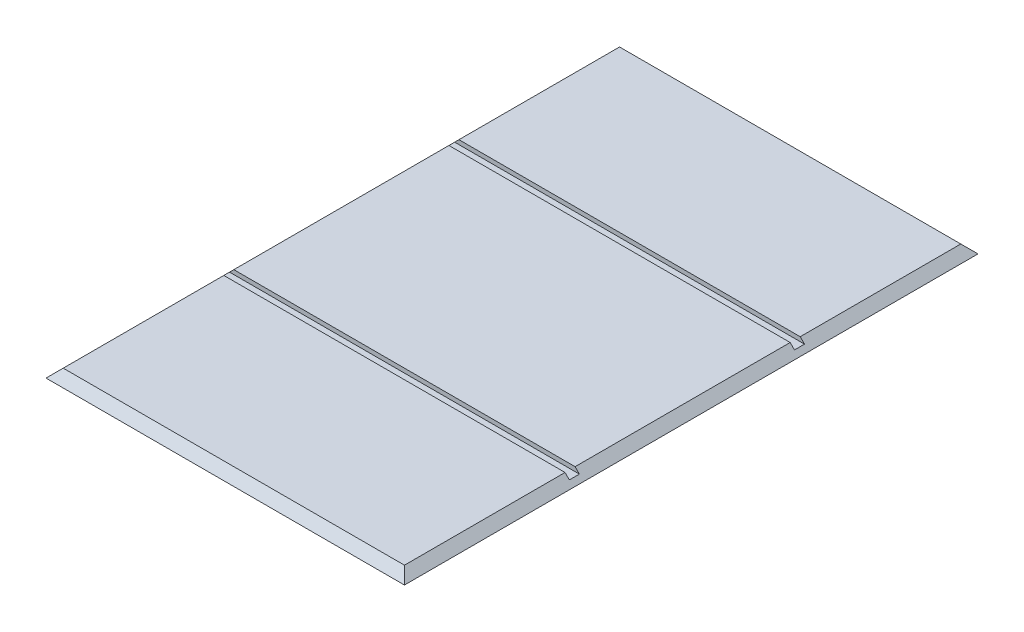
from build123d import *

# Parameters (mm, degrees)
SKETCH5_W             = 500
SKETCH5_H             = 300
BOSS_EXTRUDE1_DEPTH   = 12
SKETCH5_H_2           = 224
BOSS_EXTRUDE1_2_DEPTH = 12
BOSS_EXTRUDE1_3_DEPTH = 12
SKETCH5_3_W           = 500
SKETCH5_3_H           = 14
BOSS_EXTRUDE2_DEPTH   = 6
SKETCH5_4_W           = 500
SKETCH5_4_H           = 12
BOSS_EXTRUDE3_DEPTH   = 12
CHAMFER1_SIZE         = 12


with BuildPart() as part:
    # Sketch5 → Boss-Extrude1 (new body)
    with BuildSketch(Plane(origin=(0, 0, 0), x_dir=(1, 0, 0), z_dir=(0, 1, 0))):
        with Locations((250, 400)):
            Rectangle(SKETCH5_W, SKETCH5_H)
    extrude(amount=BOSS_EXTRUDE1_DEPTH)



with BuildPart() as body_2:
    # Sketch5 → Boss-Extrude1 2 (new body)
    with BuildSketch(Plane(origin=(0, 0, 0), x_dir=(1, 0, 0), z_dir=(0, 1, 0))):
        with Locations((250, 124)):
            Rectangle(SKETCH5_W, SKETCH5_H_2)
    extrude(amount=BOSS_EXTRUDE1_2_DEPTH)


with BuildPart() as body_3:
    # Sketch5 → Boss-Extrude1 3 (new body)
    with BuildSketch(Plane(origin=(0, 0, 0), x_dir=(1, 0, 0), z_dir=(0, 1, 0))):
        with Locations((250, 676)):
            Rectangle(SKETCH5_W, SKETCH5_H_2)
    extrude(amount=BOSS_EXTRUDE1_3_DEPTH)


with BuildPart() as part_1:
    add(part.part)

    add(body_2.part)  # Boss-Extrude2 merges body 2

    add(body_3.part)  # Boss-Extrude2 merges body 3
    # Sketch5<3> → Boss-Extrude2 (add)
    with BuildSketch(Plane(origin=(0, 0, 0), x_dir=(1, 0, 0), z_dir=(0, 1, 0))):
        with Locations((250, 243)):
            Rectangle(SKETCH5_3_W, SKETCH5_3_H)
        with Locations((250, 557)):
            Rectangle(SKETCH5_3_W, SKETCH5_3_H)
    extrude(amount=BOSS_EXTRUDE2_DEPTH)

    # Sketch5<4> → Boss-Extrude3 (add)
    with BuildSketch(Plane(origin=(0, 0, 0), x_dir=(1, 0, 0), z_dir=(0, 1, 0))):
        with Locations((250, 6)):
            Rectangle(SKETCH5_4_W, SKETCH5_4_H)
        with Locations((250, 794)):
            Rectangle(SKETCH5_4_W, SKETCH5_4_H)
    extrude(amount=BOSS_EXTRUDE3_DEPTH)

    # Chamfer1
    # the kernel refuses this chamfer: 12 mm, written as the material it takes off along each edge
    with BuildSketch(Plane(origin=(0, 12, -580.860195856), x_dir=(-0.027495876610586372, -0.9996219169112968, 0), z_dir=(0, 0, 1)), Plane(origin=(500, 12, -219.139804144), x_dir=(0.027495876610586778, -0.9996219169112968, 0), z_dir=(0, 0, -1))) as chamfer1_piece_1:
        Polygon((CHAMFER1_SIZE * 0.999621916911, CHAMFER1_SIZE * 0.0274958766106), (-CHAMFER1_SIZE * 0.0274958766106, CHAMFER1_SIZE * 0.999621916911), (0, 0), align=None)
    extrude(amount=361.720391711, mode=Mode.SUBTRACT)
    with BuildSketch(Plane(origin=(0, 12, 30.860195856), x_dir=(-0.027495876610586372, -0.9996219169112968, 0), z_dir=(0, 0, -1)), Plane(origin=(0, 12, -533.139804144), x_dir=(-0.027495876610586372, -0.9996219169112968, 0), z_dir=(0, 0, -1))) as chamfer1_piece_2:
        Polygon((CHAMFER1_SIZE * 0.999621916911, -CHAMFER1_SIZE * 0.0274958766106), (-CHAMFER1_SIZE * 0.0274958766106, -CHAMFER1_SIZE * 0.999621916911), (0, 0), align=None)
    extrude(amount=297.720391711, mode=Mode.SUBTRACT)
    with BuildSketch(Plane(origin=(500, 12, 30.860195856), x_dir=(0.027495876610586778, -0.9996219169112968, 0), z_dir=(0, 0, -1)), Plane(origin=(500, 12, -533.139804144), x_dir=(0.027495876610586778, -0.9996219169112968, 0), z_dir=(0, 0, -1))) as chamfer1_piece_3:
        Polygon((CHAMFER1_SIZE * 0.999621916911, CHAMFER1_SIZE * 0.0274958766106), (-CHAMFER1_SIZE * 0.0274958766106, CHAMFER1_SIZE * 0.999621916911), (0, 0), align=None)
    extrude(amount=297.720391711, mode=Mode.SUBTRACT)
    with BuildSketch(Plane(origin=(-30.860195856, 12, 0), x_dir=(0, -0.9996219169112968, 0.027495876610586372), z_dir=(1, 0, 0))) as chamfer1_piece_4:
        Polygon((CHAMFER1_SIZE * 0.999621916911, CHAMFER1_SIZE * 0.0274958766106), (-CHAMFER1_SIZE * 0.0274958766106, CHAMFER1_SIZE * 0.999621916911), (0, 0), align=None)
    extrude(amount=561.720391711, mode=Mode.SUBTRACT)
    with BuildSketch(Plane(origin=(530.860195856, 12, -800), x_dir=(0, 0.027495876610586462, 0.9996219169112968), z_dir=(-1, 0, 0))) as chamfer1_piece_5:
        Polygon((CHAMFER1_SIZE * 0.999621916911, -CHAMFER1_SIZE * 0.0274958766106), (-CHAMFER1_SIZE * 0.0274958766106, -CHAMFER1_SIZE * 0.999621916911), (0, 0), align=None)
    extrude(amount=561.720391711, mode=Mode.SUBTRACT)


solid = part_1.part
